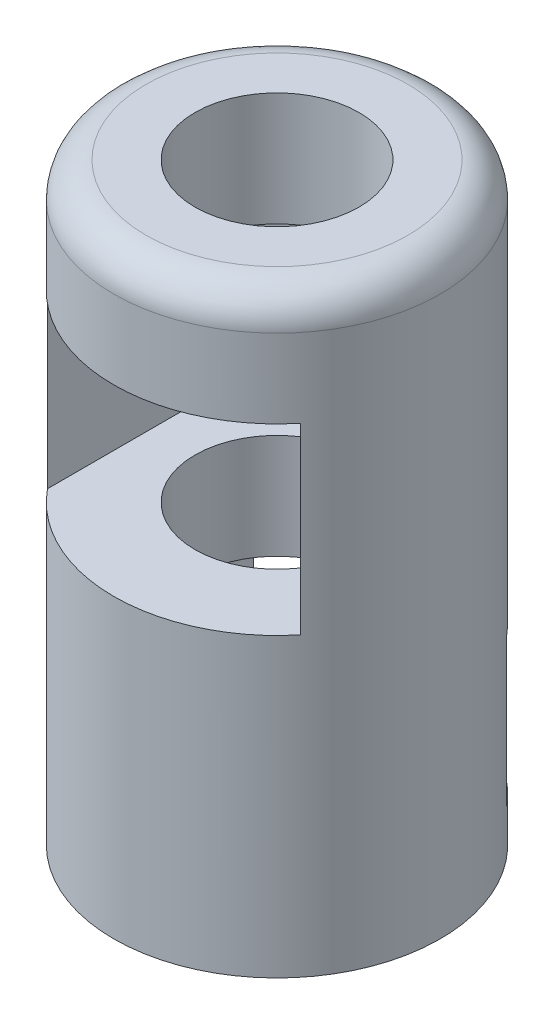
from build123d import *

# Parameters (mm, degrees)
SKETCH1_R           = 9.35
SKETCH1_R_2         = 7.5
BOSS_EXTRUDE1_DEPTH = 34
FILLET1_R           = 2
SKETCH2_R           = 7.5
BOSS_EXTRUDE2_DEPTH = 34
SKETCH3_R           = 4.7
CUT_EXTRUDE1_DEPTH  = 40
CUT_EXTRUDE2_DEPTH  = 8.5
SKETCH5_W           = 14.5
SKETCH5_H           = 8.5
CUT_EXTRUDE3_DEPTH  = 10
CUT_EXTRUDE10_DEPTH = 10.5


with BuildPart() as part:
    # Sketch1 → Boss-Extrude1 (new body)
    with BuildSketch(Plane(origin=(0, 0, 0), x_dir=(1, 0, 0), z_dir=(0, 1, 0))):
        with Locations(Location((0, 0, 0), (0, 0, 270))):
            Circle(SKETCH1_R)
        with Locations(Location((0, 0, 0), (0, 0, 270))):
            Circle(SKETCH1_R_2, mode=Mode.SUBTRACT)
    extrude(amount=BOSS_EXTRUDE1_DEPTH)

    # Fillet1
    # the kernel refuses this fillet: 2 mm, written as the material it takes off along each edge
    with BuildSketch(Plane(origin=(0, 34, 0), x_dir=(0, 0, 1), z_dir=(-1, 0, 0))) as fillet1_piece_1:
        with BuildLine():
            CenterArc((7.35, -1.994367068), FILLET1_R, 0, 85.698777695)
            Line((7.5, 0), (7.503, 0.039887341))
            ThreePointArc((7.503, 0.039887341), (8.425, 0.04), (9.35, 0.04))
            Line((9.35, 0.04), (9.39, 0))
            Line((9.39, 0), (9.39, -1.994367068))
            Line((9.39, -1.994367068), (9.35, -1.994367068))
        make_face()
    revolve(axis=Axis((0, 34, 0), (0, 1, 0)), mode=Mode.SUBTRACT)

    # Sketch2 → Boss-Extrude2 (add)
    with BuildSketch(Plane(origin=(0, 0, 0), x_dir=(-1, 0, 0), z_dir=(0, -1, 0))):
        Circle(SKETCH2_R)
    extrude(amount=-BOSS_EXTRUDE2_DEPTH)

    # Sketch3 → Cut-Extrude1 (cut)
    with BuildSketch(Plane(origin=(0, 0, 0), x_dir=(-1, 0, 0), z_dir=(0, -1, 0))):
        with Locations(Location((0, 0, 0), (0, 0, 90))):
            Circle(SKETCH3_R)
    extrude(amount=-CUT_EXTRUDE1_DEPTH, mode=Mode.SUBTRACT)

    # Sketch4 → Cut-Extrude2 (cut)
    with BuildSketch(Plane(origin=(0, 11, 0), x_dir=(1, 0, 0), z_dir=(0, 1, 0))):
        Polygon((0, -8.371578903), (7.25, -4.185789452), (7.25, 4.185789452), (0, 8.371578903), (-7.25, 4.185789452), (-7.25, -4.185789452), align=None)
    extrude(amount=-CUT_EXTRUDE2_DEPTH, mode=Mode.SUBTRACT)

    # Sketch5 → Cut-Extrude3 (cut)
    with BuildSketch(Plane.XY):
        with Locations((0, 6.75)):
            Rectangle(SKETCH5_W, SKETCH5_H)
    extrude(amount=-CUT_EXTRUDE3_DEPTH, mode=Mode.SUBTRACT)

    # Sketch6 → Cut-Extrude10 (cut)
    with BuildSketch(Plane(origin=(0, 17, 0), x_dir=(1, 0, 0), z_dir=(0, 1, 0))):
        Polygon((-7.25, 4.185789452), (-7.25, -4.185789452), (-7.25, -13.840874754), (7.25, -13.840874754), (7.25, -4.185789452), (7.25, 4.185789452), align=None)
        Polygon((7.25, 4.185789452), (-7.25, 4.185789452), (0, 8.371578903), align=None)
    extrude(amount=CUT_EXTRUDE10_DEPTH, mode=Mode.SUBTRACT)


solid = part.part
